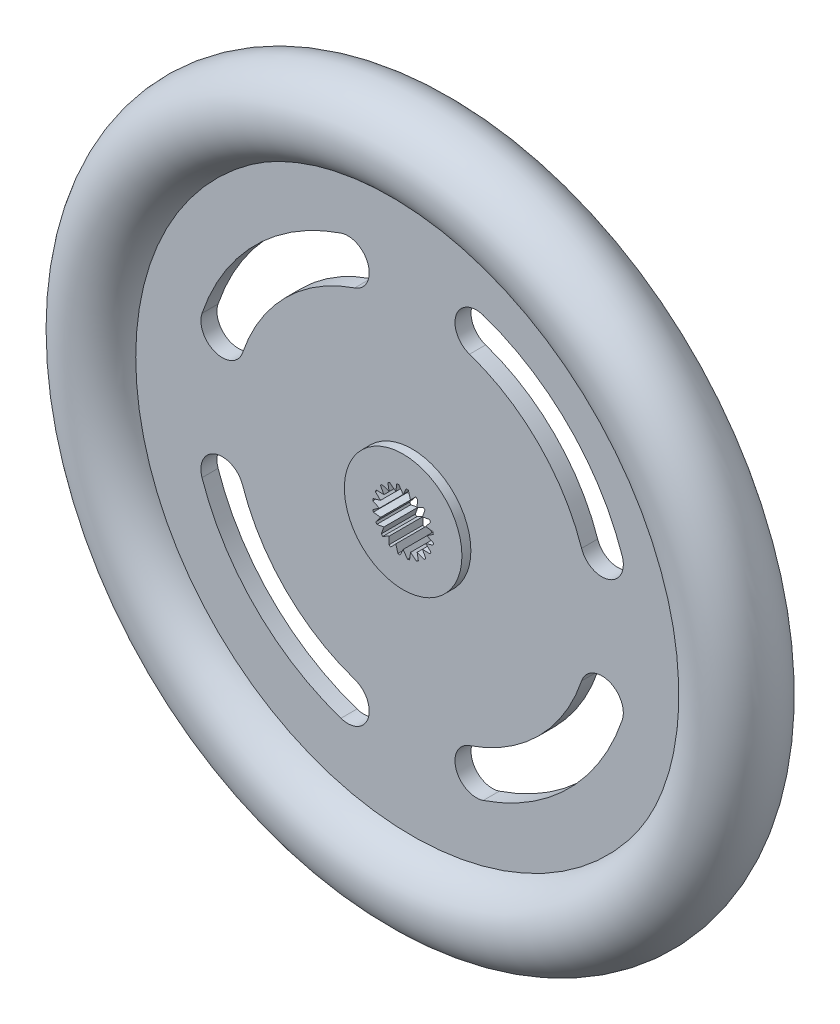
from build123d import *

# Parameters (mm, degrees)
SKETCH2_R                = 3.81
BOSS_EXTRUDE1_DEPTH      = 1.585
BOSS_EXTRUDE1_DEPTH_BACK = 1.585
SKETCH4_R                = 5.485
BOSS_EXTRUDE2_DEPTH      = 0.75
BOSS_EXTRUDE2_DEPTH_BACK = 0.75
SKETCH5_R                = 26.708345462
SKETCH5_R_2              = 4.443835797


with BuildPart() as part:
    # Sweep1: sweep along a path in Sketch1
    with BuildLine(Plane.XY) as sweep1_path:
        CenterArc((0, 0), 29.5275, 0, 360)
    # Sketch2 → Sweep1 (sweep)
    with BuildSketch(Plane(origin=(0, 0, 0), x_dir=(1, 0, 0), z_dir=(0, 1, 0))):
        with Locations((-29.5275, 0)):
            Circle(SKETCH2_R)
    sweep(path=sweep1_path.line)


with BuildPart() as body_2:
    # Sketch4 → Boss-Extrude1 (new, two sides: drawn at the far end of the back side and taken through both)
    with BuildSketch(Plane.XY.offset(-BOSS_EXTRUDE1_DEPTH_BACK)):
        with Locations((9.906, -10.287)):
            Circle(SKETCH4_R)
        with BuildLine():
            Line((9.502446481, -7.47395), (9.906, -8.063711559))
            Line((9.906, -8.063711559), (10.196958476, -7.460084913))
            ThreePointArc((10.196958476, -7.460084913), (10.294450159, -7.471824656), (10.391478053, -7.486925571))
            Line((10.391478053, -7.486925571), (10.593033912, -8.172527041))
            Line((10.593033912, -8.172527041), (11.056282758, -7.688355099))
            ThreePointArc((11.056282758, -7.688355099), (11.145375078, -7.729646845), (11.232987649, -7.773991937))
            Line((11.232987649, -7.773991937), (11.212816157, -8.488321868))
            Line((11.212816157, -8.488321868), (11.803009349, -8.170998754))
            ThreePointArc((11.803009349, -8.170998754), (11.87498133, -8.237800579), (11.944602449, -8.307049041))
            Line((11.944602449, -8.307049041), (11.704678132, -8.980183843))
            Line((11.704678132, -8.980183843), (12.364043448, -8.860771354))
            ThreePointArc((12.364043448, -8.860771354), (12.41184997, -8.94654423), (12.456664638, -9.03391754))
            Line((12.456664638, -9.03391754), (12.020472959, -9.599966088))
            Line((12.020472959, -9.599966088), (12.684467128, -9.690153151))
            ThreePointArc((12.684467128, -9.690153151), (12.703428556, -9.786501031), (12.71905, -9.883446481))
            Line((12.71905, -9.883446481), (12.129288441, -10.287))
            Line((12.129288441, -10.287), (12.732915087, -10.577958476))
            ThreePointArc((12.732915087, -10.577958476), (12.721175344, -10.675450159), (12.706074429, -10.772478053))
            Line((12.706074429, -10.772478053), (12.020472959, -10.974033912))
            Line((12.020472959, -10.974033912), (12.504644901, -11.437282758))
            ThreePointArc((12.504644901, -11.437282758), (12.463353155, -11.526375078), (12.419008063, -11.613987649))
            Line((12.419008063, -11.613987649), (11.704678132, -11.593816157))
            Line((11.704678132, -11.593816157), (12.022001246, -12.184009349))
            ThreePointArc((12.022001246, -12.184009349), (11.955199421, -12.25598133), (11.885950959, -12.325602449))
            Line((11.885950959, -12.325602449), (11.212816157, -12.085678132))
            Line((11.212816157, -12.085678132), (11.332228646, -12.745043448))
            ThreePointArc((11.332228646, -12.745043448), (11.24645577, -12.79284997), (11.15908246, -12.837664638))
            Line((11.15908246, -12.837664638), (10.593033912, -12.401472959))
            Line((10.593033912, -12.401472959), (10.502846849, -13.065467128))
            ThreePointArc((10.502846849, -13.065467128), (10.406498969, -13.084428556), (10.309553519, -13.10005))
            Line((10.309553519, -13.10005), (9.906, -12.510288441))
            Line((9.906, -12.510288441), (9.615041524, -13.113915087))
            ThreePointArc((9.615041524, -13.113915087), (9.517549841, -13.102175344), (9.420521947, -13.087074429))
            Line((9.420521947, -13.087074429), (9.218966088, -12.401472959))
            Line((9.218966088, -12.401472959), (8.755717242, -12.885644901))
            ThreePointArc((8.755717242, -12.885644901), (8.666624922, -12.844353155), (8.579012351, -12.800008063))
            Line((8.579012351, -12.800008063), (8.599183843, -12.085678132))
            Line((8.599183843, -12.085678132), (8.008990651, -12.403001246))
            ThreePointArc((8.008990651, -12.403001246), (7.93701867, -12.336199421), (7.867397551, -12.266950959))
            Line((7.867397551, -12.266950959), (8.107321868, -11.593816157))
            Line((8.107321868, -11.593816157), (7.447956552, -11.713228646))
            ThreePointArc((7.447956552, -11.713228646), (7.40015003, -11.62745577), (7.355335362, -11.54008246))
            Line((7.355335362, -11.54008246), (7.791527041, -10.974033912))
            Line((7.791527041, -10.974033912), (7.127532872, -10.883846849))
            ThreePointArc((7.127532872, -10.883846849), (7.108571444, -10.787498969), (7.09295, -10.690553519))
            Line((7.09295, -10.690553519), (7.682711559, -10.287))
            Line((7.682711559, -10.287), (7.079084913, -9.996041524))
            ThreePointArc((7.079084913, -9.996041524), (7.090824656, -9.898549841), (7.105925571, -9.801521947))
            Line((7.105925571, -9.801521947), (7.791527041, -9.599966088))
            Line((7.791527041, -9.599966088), (7.307355099, -9.136717242))
            ThreePointArc((7.307355099, -9.136717242), (7.348646845, -9.047624922), (7.392991937, -8.960012351))
            Line((7.392991937, -8.960012351), (8.107321868, -8.980183843))
            Line((8.107321868, -8.980183843), (7.789998754, -8.389990651))
            ThreePointArc((7.789998754, -8.389990651), (7.856800579, -8.31801867), (7.926049041, -8.248397551))
            Line((7.926049041, -8.248397551), (8.599183843, -8.488321868))
            Line((8.599183843, -8.488321868), (8.479771354, -7.828956552))
            ThreePointArc((8.479771354, -7.828956552), (8.56554423, -7.78115003), (8.65291754, -7.736335362))
            Line((8.65291754, -7.736335362), (9.218966088, -8.172527041))
            Line((9.218966088, -8.172527041), (9.309153151, -7.508532872))
            ThreePointArc((9.309153151, -7.508532872), (9.405501031, -7.489571444), (9.502446481, -7.47395))
        make_face(mode=Mode.SUBTRACT)
    extrude(amount=BOSS_EXTRUDE1_DEPTH + BOSS_EXTRUDE1_DEPTH_BACK)


with BuildPart() as body_3:
    # Sketch5 → Boss-Extrude2 (new, two sides: drawn at the far end of the back side and taken through both)
    with BuildSketch(Plane.XY.offset(-BOSS_EXTRUDE2_DEPTH_BACK)):
        Circle(SKETCH5_R)
        Circle(SKETCH5_R_2, mode=Mode.SUBTRACT)
        with BuildLine():
            ThreePointArc((19.605748825, 6.641704905), (14.637240707, 14.637240707), (6.641704905, 19.605748825))
            ThreePointArc((6.641704905, 19.605748825), (4.105741619, 18.353195349), (5.358295095, 15.817232063))
            ThreePointArc((5.358295095, 15.817232063), (11.808813583, 11.808813583), (15.817232063, 5.358295095))
            ThreePointArc((15.817232063, 5.358295095), (18.353195349, 4.105741619), (19.605748825, 6.641704905))
        make_face(mode=Mode.SUBTRACT)
        with BuildLine():
            ThreePointArc((-6.641704905, 19.605748825), (-14.637240707, 14.637240707), (-19.605748825, 6.641704905))
            ThreePointArc((-19.605748825, 6.641704905), (-18.353195349, 4.105741619), (-15.817232063, 5.358295095))
            ThreePointArc((-15.817232063, 5.358295095), (-11.808813583, 11.808813583), (-5.358295095, 15.817232063))
            ThreePointArc((-5.358295095, 15.817232063), (-4.105741619, 18.353195349), (-6.641704905, 19.605748825))
        make_face(mode=Mode.SUBTRACT)
        with BuildLine():
            ThreePointArc((6.641704905, -19.605748825), (14.637240707, -14.637240707), (19.605748825, -6.641704905))
            ThreePointArc((19.605748825, -6.641704905), (18.353195349, -4.105741619), (15.817232063, -5.358295095))
            ThreePointArc((15.817232063, -5.358295095), (11.808813583, -11.808813583), (5.358295095, -15.817232063))
            ThreePointArc((5.358295095, -15.817232063), (4.105741619, -18.353195349), (6.641704905, -19.605748825))
        make_face(mode=Mode.SUBTRACT)
        with BuildLine():
            ThreePointArc((-19.605748825, -6.641704905), (-14.637240707, -14.637240707), (-6.641704905, -19.605748825))
            ThreePointArc((-6.641704905, -19.605748825), (-4.105741619, -18.353195349), (-5.358295095, -15.817232063))
            ThreePointArc((-5.358295095, -15.817232063), (-11.808813583, -11.808813583), (-15.817232063, -5.358295095))
            ThreePointArc((-15.817232063, -5.358295095), (-18.353195349, -4.105741619), (-19.605748825, -6.641704905))
        make_face(mode=Mode.SUBTRACT)
    extrude(amount=BOSS_EXTRUDE2_DEPTH + BOSS_EXTRUDE2_DEPTH_BACK)


with BuildPart() as body_2_1:
    # Body-Move/Copy1: read off the stored shape, not the designer's step
    # Body-Move/Copy1: moved
    add(body_2.part.moved(Location((-9.906, 10.287, 0))))


with BuildPart() as body_3_1:
    add(body_3.part)

    # Combine3: union body 2, part
    add(body_2_1.part)
    add(part.part)


solid = body_3_1.part
